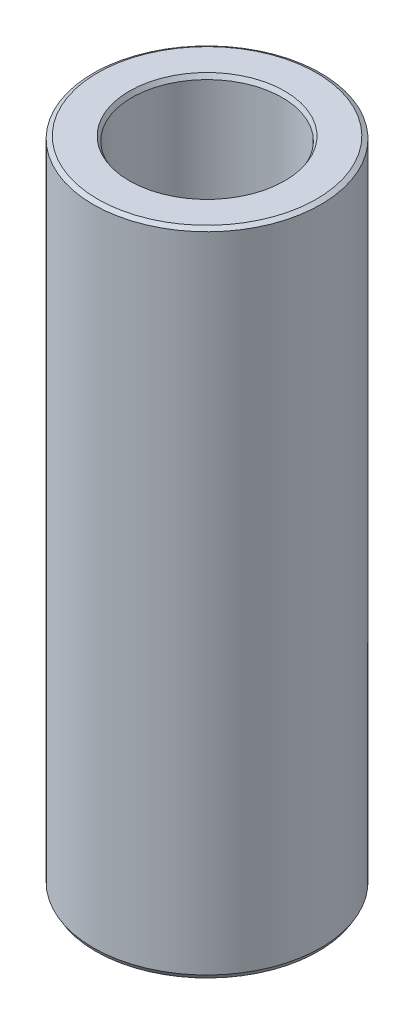
from build123d import *
from OCP.BRepFilletAPI import BRepFilletAPI_MakeChamfer

# Parameters (mm, degrees)
SKETCH1_R           = 35
BOSS_EXTRUDE1_DEPTH = 200.072638794
SKETCH2_R           = 23.140460139
CUT_EXTRUDE1_DEPTH  = 207.10448999
CHAMFER1_SIZE       = 0.773100382
CHAMFER1_SIZE2      = 1.33904914


with BuildPart() as part:
    # Sketch1 → Boss-Extrude1 (new body)
    with BuildSketch(Plane(origin=(0, 0, 0), x_dir=(1, 0, 0), z_dir=(0, 1, 0))):
        Circle(SKETCH1_R)
    extrude(amount=BOSS_EXTRUDE1_DEPTH)

    # Sketch2 → Cut-Extrude1 (cut, through all)
    with BuildSketch(Plane(origin=(0, 0, 0), x_dir=(1, 0, 0), z_dir=(0, 1, 0))):
        Circle(SKETCH2_R)
    extrude(amount=CUT_EXTRUDE1_DEPTH, mode=Mode.SUBTRACT)

    # Chamfer1: one chamfer whose edges measure the first distance from different faces: ONE call of the kernel's chamfer builder (chamfer() names one face for all edges)
    chamfer1_edges_1 = [part.edges().sort_by_distance(p)[0] for p in [
        (-23.140460139, 200.072638794, 0),
    ]]
    chamfer1_side_1 = [part.faces().sort_by_distance(p)[0] for p in [
        (-34.010050506, 200.072638794, 0),
    ]]
    chamfer1_edges_2 = [part.edges().sort_by_distance(p)[0] for p in [
        (-23.140460139, 0, 0),
    ]]
    chamfer1_side_2 = [part.faces().sort_by_distance(p)[0] for p in [
        (-23.140460139, 100.036319397, 0),
    ]]
    chamfer1_edges_3 = [part.edges().sort_by_distance(p)[0] for p in [
        (-35, 0, 0),
    ]]
    chamfer1_side_3 = [part.faces().sort_by_distance(p)[0] for p in [
        (-34.010050506, 0, 0),
    ]]
    chamfer1_edges_4 = [part.edges().sort_by_distance(p)[0] for p in [
        (-35, 200.072638794, 0),
    ]]
    chamfer1_side_4 = [part.faces().sort_by_distance(p)[0] for p in [
        (-35, 100.036319397, 0),
    ]]
    chamfer1 = BRepFilletAPI_MakeChamfer(part.part.solid().wrapped)
    for e in chamfer1_edges_1:
        chamfer1.Add(CHAMFER1_SIZE, CHAMFER1_SIZE2, e.wrapped, chamfer1_side_1[0].wrapped)  # the first distance lies on this face
    for e in chamfer1_edges_2:
        chamfer1.Add(CHAMFER1_SIZE, CHAMFER1_SIZE2, e.wrapped, chamfer1_side_2[0].wrapped)  # the first distance lies on this face
    for e in chamfer1_edges_3:
        chamfer1.Add(CHAMFER1_SIZE, CHAMFER1_SIZE2, e.wrapped, chamfer1_side_3[0].wrapped)  # the first distance lies on this face
    for e in chamfer1_edges_4:
        chamfer1.Add(CHAMFER1_SIZE, CHAMFER1_SIZE2, e.wrapped, chamfer1_side_4[0].wrapped)  # the first distance lies on this face
    add(Compound.cast(chamfer1.Shape()), mode=Mode.REPLACE)


solid = part.part
